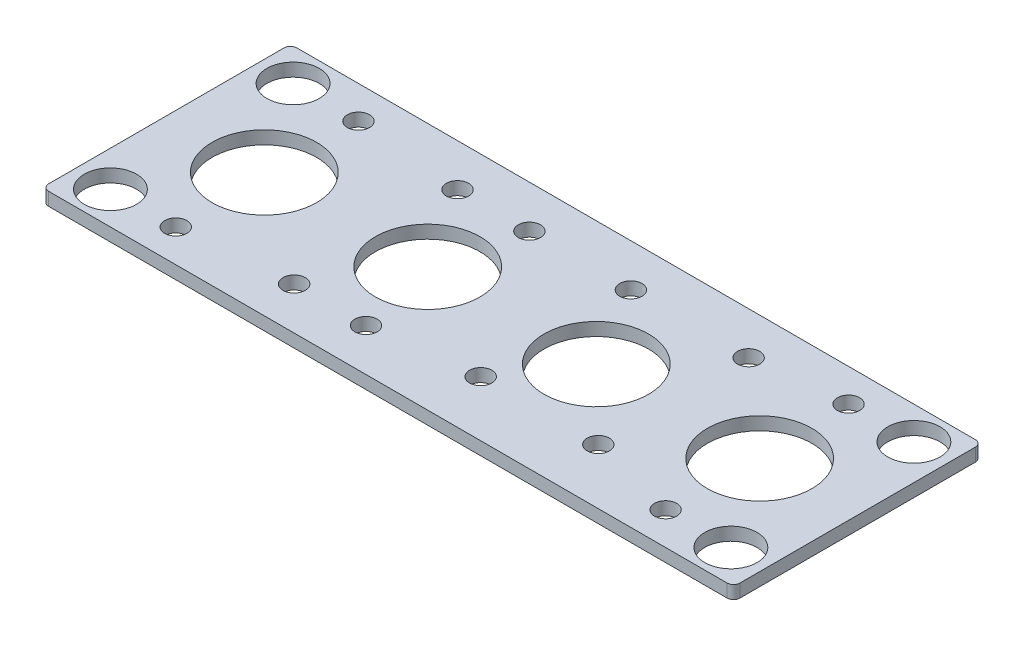
from build123d import *

# Parameters (mm, degrees)
SKETCH1_W           = 105.8
SKETCH1_H           = 37.999959088
SKETCH1_R           = 4
SKETCH1_R_2         = 1.7
SKETCH1_R_3         = 8
BOSS_EXTRUDE3_DEPTH = 2
FILLET1_R           = 1


with BuildPart() as part:
    # Sketch1 → Boss-Extrude3 (new body)
    with BuildSketch(Plane(origin=(0, 0, 0), x_dir=(1, 0, 0), z_dir=(0, 1, 0))):
        with Locations((0, -2.0456e-05)):
            Rectangle(SKETCH1_W, SKETCH1_H)
        with Locations((-47.5, 13.999959088)):
            Circle(SKETCH1_R, mode=Mode.SUBTRACT)
        with Locations((-47.45213511, -14)):
            Circle(SKETCH1_R, mode=Mode.SUBTRACT)
        with Locations((47.5, 13.999959088)):
            Circle(SKETCH1_R, mode=Mode.SUBTRACT)
        with Locations((47.5, -14.000040912)):
            Circle(SKETCH1_R, mode=Mode.SUBTRACT)
        with Locations((-20.838777713, 12.499959088)):
            Circle(SKETCH1_R_2, mode=Mode.SUBTRACT)
        with Locations((-20.838777713, -12.500040912)):
            Circle(SKETCH1_R_2, mode=Mode.SUBTRACT)
        with Locations((-9.838777713, 12.499959088)):
            Circle(SKETCH1_R_2, mode=Mode.SUBTRACT)
        with Locations((-9.838777713, -12.500040912)):
            Circle(SKETCH1_R_2, mode=Mode.SUBTRACT)
        with Locations((5.708304913, 12.482293054)):
            Circle(SKETCH1_R_2, mode=Mode.SUBTRACT)
        with Locations((5.708304913, -10.500040912)):
            Circle(SKETCH1_R_2, mode=Mode.SUBTRACT)
        with Locations((23.708296244, 12.499959088)):
            Circle(SKETCH1_R_2, mode=Mode.SUBTRACT)
        with Locations((23.708296244, -10.500040912)):
            Circle(SKETCH1_R_2, mode=Mode.SUBTRACT)
        with Locations((-37.5, 13.999959088)):
            Circle(SKETCH1_R_2, mode=Mode.SUBTRACT)
        with Locations((-37.45213511, -14)):
            Circle(SKETCH1_R_2, mode=Mode.SUBTRACT)
        with Locations((37.5, 13.999959088)):
            Circle(SKETCH1_R_2, mode=Mode.SUBTRACT)
        with Locations((37.5, -14.000040912)):
            Circle(SKETCH1_R_2, mode=Mode.SUBTRACT)
        with Locations((-37.9, 0)):
            Circle(SKETCH1_R_3, mode=Mode.SUBTRACT)
        with Locations((-12.9, 0)):
            Circle(SKETCH1_R_3, mode=Mode.SUBTRACT)
        with Locations((37.9, 0)):
            Circle(SKETCH1_R_3, mode=Mode.SUBTRACT)
        with Locations((12.9, 0)):
            Circle(SKETCH1_R_3, mode=Mode.SUBTRACT)
    extrude(amount=BOSS_EXTRUDE3_DEPTH)

    # Fillet1
    fillet1_edges = [part.edges().sort_by_distance(p)[0] for p in [
        (52.9, 1, -18.999959088),
        (52.9, 1, 19),
        (-52.9, 1, -18.999959088),
        (-52.9, 1, 19),
    ]]
    fillet(fillet1_edges, radius=FILLET1_R)


solid = part.part
